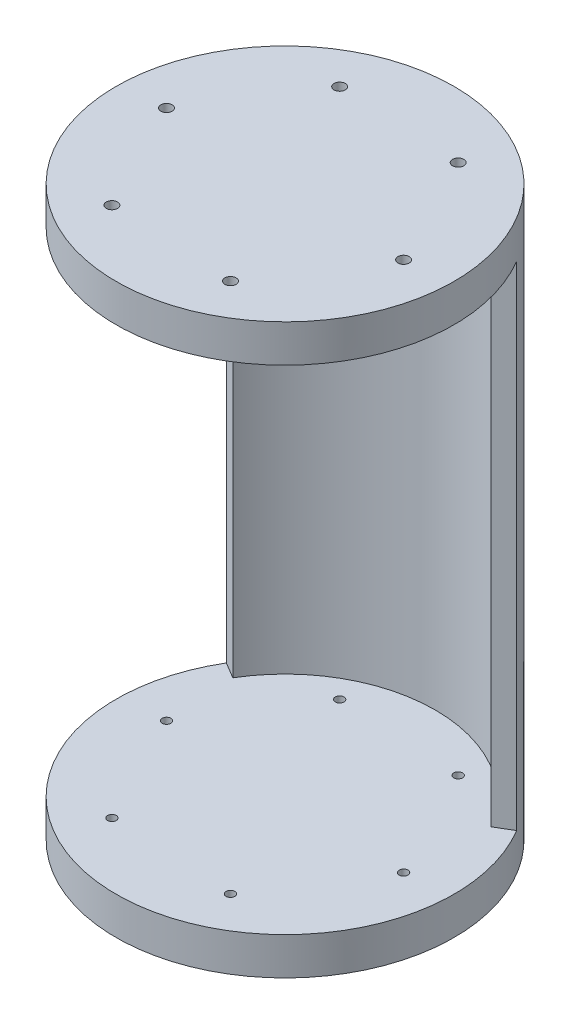
from build123d import *

# Parameters (mm, degrees)
BOSS_EXTRUDE1_DEPTH = 197
BOSS_EXTRUDE2_START = 15
SKETCH2_R           = 67.5
BOSS_EXTRUDE2_DEPTH = 15
SKETCH3_R           = 2.25
CUT_EXTRUDE1_DEPTH  = 10
SKETCH4_R           = 1.75
CUT_EXTRUDE2_DEPTH  = 14


with BuildPart() as part:
    # Sketch1 → Boss-Extrude1 (new body)
    with BuildSketch(Plane(origin=(0, 0, 0), x_dir=(1, 0, 0), z_dir=(0, 1, 0))):
        with BuildLine():
            Line((-57.995021896, 34.537333935), (-51.551130574, 30.699852387))
            ThreePointArc((-51.551130574, 30.699852387), (0, 60), (51.551130574, 30.699852387))
            Line((51.551130574, 30.699852387), (57.995021896, 34.537333935))
            ThreePointArc((57.995021896, 34.537333935), (0, 67.5), (-57.995021896, 34.537333935))
        make_face()
    boss_extrude1 = extrude(amount=BOSS_EXTRUDE1_DEPTH)

    # Sketch2 → Boss-Extrude2 (add)
    with BuildSketch(Plane.XZ.offset(BOSS_EXTRUDE2_START)):
        Circle(SKETCH2_R)
    boss_extrude2 = extrude(amount=-BOSS_EXTRUDE2_DEPTH)

    # Sketch3 → Cut-Extrude1 (cut)
    with BuildSketch(Plane.XZ.offset(15)):
        with Locations((22.727417579, 44.536103222)):
            Circle(SKETCH3_R)
        with Locations((49.933105565, 2.585530625)):
            Circle(SKETCH3_R)
        with Locations((27.205687986, -41.950572597)):
            Circle(SKETCH3_R)
        with Locations((-22.727417579, -44.536103222)):
            Circle(SKETCH3_R)
        with Locations((-49.933105565, -2.585530625)):
            Circle(SKETCH3_R)
        with Locations((-27.205687986, 41.950572597)):
            Circle(SKETCH3_R)
    cut_extrude1 = extrude(amount=-CUT_EXTRUDE1_DEPTH, mode=Mode.SUBTRACT)

    # Sketch4 → Cut-Extrude2 (cut)
    with BuildSketch(Plane.XZ.offset(5)):
        with Locations((22.727417579, 44.536103222)):
            Circle(SKETCH4_R)
        with Locations((49.933105565, 2.585530625)):
            Circle(SKETCH4_R)
        with Locations((27.205687986, -41.950572597)):
            Circle(SKETCH4_R)
        with Locations((-22.727417579, -44.536103222)):
            Circle(SKETCH4_R)
        with Locations((-49.933105565, -2.585530625)):
            Circle(SKETCH4_R)
        with Locations((-27.205687986, 41.950572597)):
            Circle(SKETCH4_R)
    cut_extrude2 = extrude(amount=-CUT_EXTRUDE2_DEPTH, mode=Mode.SUBTRACT)

    # Mirror1: Boss-Extrude1, Boss-Extrude2, Cut-Extrude1 across plane
    add(boss_extrude1.mirror(Plane.ZX.offset(98.5)))
    add(boss_extrude2.mirror(Plane.ZX.offset(98.5)))
    add(cut_extrude1.mirror(Plane.ZX.offset(98.5)), mode=Mode.SUBTRACT)

    # Mirror2: Cut-Extrude2 across plane
    add(cut_extrude2.mirror(Plane.ZX.offset(98.5)), mode=Mode.SUBTRACT)


solid = part.part
